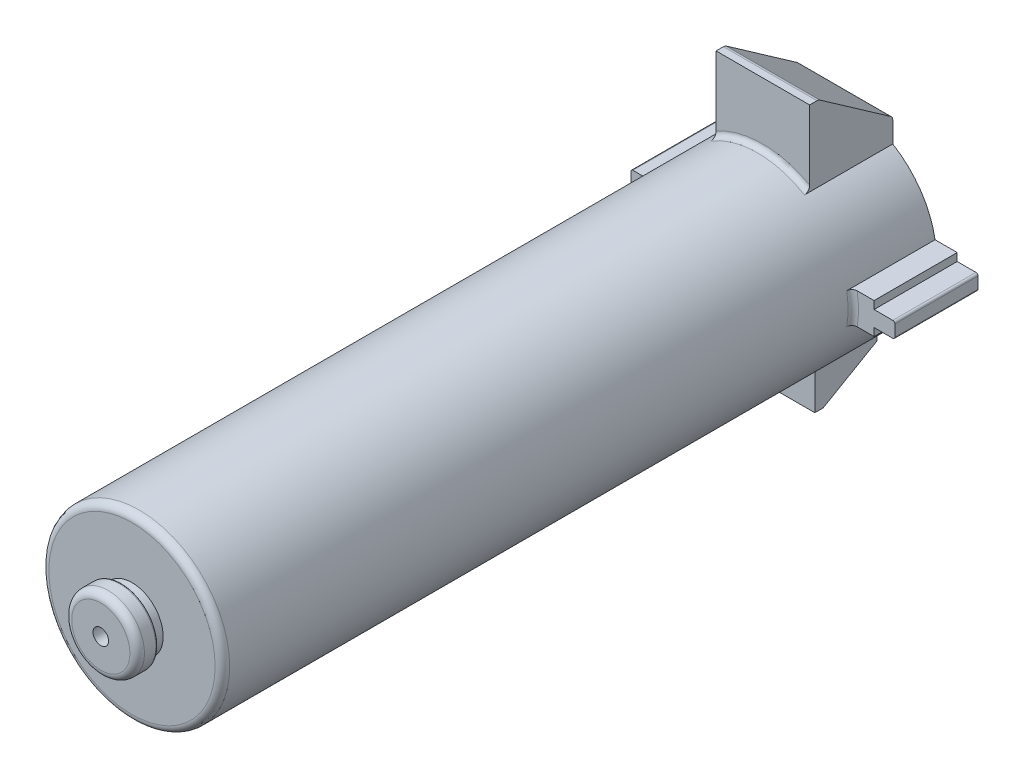
from build123d import *

# Parameters (mm, degrees)
SKETCH_1_R          = 8.7
SKETCH_1_R_2        = 7.2
EXTRUDE_1_DEPTH     = 67
SKETCH_3_R          = 8.7
EXTRUDE_1_2_DEPTH   = 1.7
SKETCH_4_R          = 3
EXTRUDE_2_DEPTH     = 1
SKETCH_5_R          = 3.5
EXTRUDE_3_DEPTH     = 2
FILLET_1_R          = 0.7
FILLET_2_R          = 0.2
FILLET_3_R          = 0.7
SKETCH_6_W          = 9
SKETCH_6_H          = 7.5
EXTRUDE_4_DEPTH     = 8
CHAMFER_1_SIZE      = 5
CHAMFER_1_SIZE2     = 7.140740034
FILLET_4_R          = 0.5
SKETCH_7_W          = 6
SKETCH_7_H          = 5.5
EXTRUDE_5_DEPTH     = 6
CHAMFER_2_SIZE      = 3
CHAMFER_2_SIZE2     = 5.196152423
FILLET_5_R          = 0.2
EXTRUDE_6_DEPTH     = 8
FILLET_6_R          = 0.2
SKETCH_9_R          = 0.75
CUT_EXTRUDE_1_DEPTH = 75.285059063
FILLET_7_R          = 0.5


with BuildPart() as part:
    # Эскиз1 → Extrude 1 (new body)
    with BuildSketch(Plane.XY):
        Circle(SKETCH_1_R)
        Circle(SKETCH_1_R_2, mode=Mode.SUBTRACT)
    extrude(amount=EXTRUDE_1_DEPTH)

    # Эскиз3 → Extrude 1 2 (add)
    with BuildSketch(Plane.XY.offset(67)):
        Circle(SKETCH_3_R)
    extrude(amount=EXTRUDE_1_2_DEPTH)

    # Эскиз4 → Бобышка-Вытянуть2 (add)
    with BuildSketch(Plane.XY.offset(68.7)):
        Circle(SKETCH_4_R)
    extrude(amount=EXTRUDE_2_DEPTH)

    # Эскиз5 → Бобышка-Вытянуть3 (add)
    with BuildSketch(Plane.XY.offset(69.7)):
        Circle(SKETCH_5_R)
    extrude(amount=EXTRUDE_3_DEPTH)

    # Скругление1
    fillet_1_edges = [part.edges().sort_by_distance(p)[0] for p in [
        (-3.5, 0, 71.7),
    ]]
    fillet(fillet_1_edges, radius=FILLET_1_R)

    # Скругление2
    fillet_2_edges = [part.edges().sort_by_distance(p)[0] for p in [
        (-3.5, 0, 69.7),
    ]]
    fillet(fillet_2_edges, radius=FILLET_2_R)

    # Скругление3
    fillet_3_edges = [part.edges().sort_by_distance(p)[0] for p in [
        (-8.7, 0, 68.7),
    ]]
    fillet(fillet_3_edges, radius=FILLET_3_R)

    # Эскиз6 → Бобышка-Вытянуть4 (add)
    with BuildSketch(Plane(origin=(0, 0, 0), x_dir=(-1, 0, 0), z_dir=(0, 0, -1))):
        with Locations((0, 10.95)):
            Rectangle(SKETCH_6_W, SKETCH_6_H)
    extrude(amount=-EXTRUDE_4_DEPTH)

    # Фаска1
    chamfer_1_edges = [part.edges().sort_by_distance(p)[0] for p in [
        (0, 14.7, 0),
    ]]
    chamfer_1_side = [part.faces().sort_by_distance(p)[0] for p in [
        (-4.131076687, -7.323616213, 0),
    ]]
    chamfer(chamfer_1_edges, length=CHAMFER_1_SIZE, length2=CHAMFER_1_SIZE2, reference=chamfer_1_side[0])

    # Скругление4
    fillet_4_edges = [part.edges().sort_by_distance(p)[0] for p in [
        (0, 9.7, 0),
        (0, 14.7, 7.140740034),
    ]]
    fillet(fillet_4_edges, radius=FILLET_4_R)

    # Эскиз7 → Бобышка-Вытянуть5 (add)
    with BuildSketch(Plane(origin=(0, 0, 0), x_dir=(-1, 0, 0), z_dir=(0, 0, -1))):
        with Locations((0, -9.95)):
            Rectangle(SKETCH_7_W, SKETCH_7_H)
    extrude(amount=-EXTRUDE_5_DEPTH)

    # Фаска2
    chamfer_2_edges = [part.edges().sort_by_distance(p)[0] for p in [
        (0, -12.7, 0),
    ]]
    chamfer_2_side = [part.faces().sort_by_distance(p)[0] for p in [
        (4.218410397, 8.442760331, 0),
    ]]
    chamfer(chamfer_2_edges, length=CHAMFER_2_SIZE, length2=CHAMFER_2_SIZE2, reference=chamfer_2_side[0])

    # Скругление5
    fillet_5_edges = [part.edges().sort_by_distance(p)[0] for p in [
        (0, -12.7, 5.196152423),
        (0, -9.7, 0),
    ]]
    fillet(fillet_5_edges, radius=FILLET_5_R)

    # Эскиз8 → Бобышка-Вытянуть6 (add)
    with BuildSketch(Plane(origin=(0, 0, 0), x_dir=(-1, 0, 0), z_dir=(0, 0, -1))):
        Polygon((-10.7, -0.75), (-10.7, -1.5), (-7.2, -1.5), (-7.2, 1.5), (-10.7, 1.5), (-10.7, 0.75), (-12.7, 0.75), (-12.7, -0.75), align=None)
        Polygon((10.7, 1.5), (10.7, 0.75), (12.7, 0.75), (12.7, -0.75), (10.7, -0.75), (10.7, -1.5), (7.2, -1.5), (7.2, 1.5), align=None)
    extrude(amount=-EXTRUDE_6_DEPTH)

    # Скругление6
    fillet_6_edges = [part.edges().sort_by_distance(p)[0] for p in [
        (-12.7, -0.75, 4),
        (-12.7, 0.75, 4),
        (12.7, -0.75, 4),
        (12.7, 0.75, 4),
    ]]
    fillet(fillet_6_edges, radius=FILLET_6_R)

    # Эскиз9 → Вырез-Вытянуть1 (cut, through all)
    with BuildSketch(Plane.XY.offset(71.7)):
        Circle(SKETCH_9_R)
    extrude(amount=-CUT_EXTRUDE_1_DEPTH, mode=Mode.SUBTRACT)

    # Скругление7
    fillet_7_edges = [part.edges().sort_by_distance(p)[0] for p in [
        (0, -8.7, 6),
        (0, 8.7, 8),
        (8.667367328, 0.752823753, 8),
        (-8.7, 0, 8),
    ]]
    fillet(fillet_7_edges, radius=FILLET_7_R)


solid = part.part
